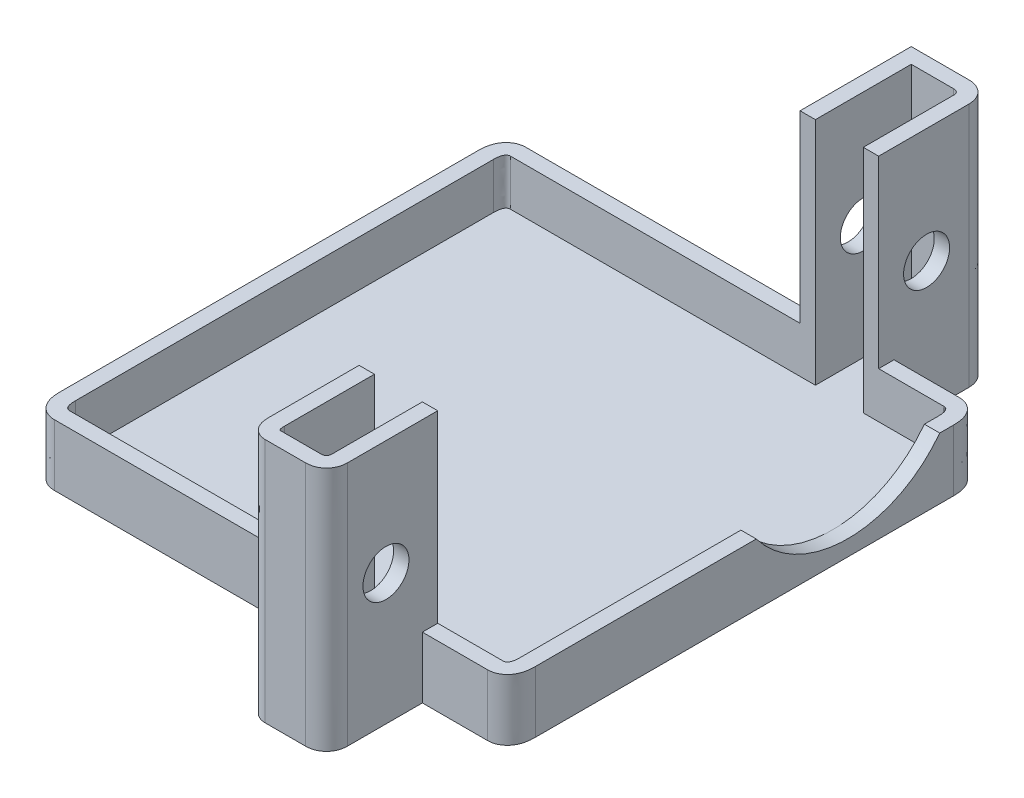
from build123d import *

# Parameters (mm, degrees)
EXTRUDE_THIN1_DEPTH     = 2.4
CUT_EXTRUDE1_DEPTH      = 10
BOSS_EXTRUDE1_DEPTH     = 0.8
BOSS_EXTRUDE2_DEPTH     = 9.6
CUT_EXTRUDE2_DEPTH      = 10
CUT_EXTRUDE2_DEPTH_BACK = 9.6
SKETCH5_R               = 1.2
BOSS_EXTRUDE3_DEPTH     = 9.6
CUT_EXTRUDE3_DEPTH      = 10
CUT_EXTRUDE3_DEPTH_BACK = 9.6
SKETCH8_R               = 1.2


# Read off the part's stored shape, not the designer's step: Extrude-Thin1
with BuildPart() as part:
    # Extrude-Thin1 outline → Extrude-Thin1 (new body)
    with BuildSketch(Plane(origin=(0, 27.577339236, 0), x_dir=(1, 0, 0), z_dir=(0, 1, 0))):
        with BuildLine():
            Line((-221.85268026, 260.465727588), (-224.85268026, 260.465727588))
            Line((-224.85268026, 260.465727588), (-224.85268026, 255.465727588))
            Line((-224.85268026, 255.465727588), (-239.95268026, 255.465727588))
            add(Edge.make_bspline(
                [(-239.95268026, 255.465727588), (-240.036953855, 255.465727588), (-240.119634905, 255.456128928), (-240.281715302, 255.417151974), (-240.361409143, 255.387305758), (-240.582321505, 255.271729013), (-240.710305754, 255.157186074), (-240.902423276, 254.88238325), (-240.965907148, 254.723899526), (-241.040211449, 254.398738857), (-241.05268026, 254.23302474), (-241.05268026, 254.065727588)],
                knots=[0, 0, 0, 0, 0.125, 0.125, 0.25, 0.25, 0.5, 0.5, 0.75, 0.75, 1, 1, 1, 1], degree=3))
            Line((-241.05268026, 254.065727588), (-241.05268026, 232.26572715))
            add(Edge.make_bspline(
                [(-241.05268026, 232.26572715), (-241.05268026, 232.098807375), (-241.040173408, 231.934007095), (-240.967365099, 231.612506131), (-240.904171119, 231.452780727), (-240.761375105, 231.246738134), (-240.705083291, 231.182493851), (-240.580845123, 231.071317608), (-240.512324697, 231.023373693), (-240.287950739, 230.905193813), (-240.121895067, 230.865727588), (-239.95268026, 230.865727588)],
                knots=[0, 0, 0, 0, 0.25, 0.25, 0.5, 0.5, 0.625, 0.625, 0.75, 0.75, 1, 1, 1, 1], degree=3))
            Line((-239.95268026, 230.865727588), (-224.85268026, 230.865727588))
            Line((-224.85268026, 230.865727588), (-224.85268026, 226.965727588))
            add(Edge.make_bspline(
                [(-224.85268026, 226.965727588), (-224.85268026, 226.832263963), (-224.842915454, 226.699977447), (-224.778312529, 226.440837832), (-224.722765281, 226.317121604), (-224.561642632, 226.104378576), (-224.457129257, 226.016716914), (-224.220278277, 225.897626505), (-224.087183417, 225.865727588), (-223.95268026, 225.865727588)],
                knots=[0, 0, 0, 0, 0.25, 0.25, 0.5, 0.5, 0.75, 0.75, 1, 1, 1, 1], degree=3))
            Line((-223.95268026, 225.865727588), (-221.85268026, 225.865727588))
            add(Edge.make_bspline(
                [(-221.85268026, 225.865727588), (-221.706401491, 225.865727588), (-221.561598635, 225.889080891), (-221.357734958, 225.966629211), (-221.293267189, 225.998955372), (-221.171531343, 226.076981138), (-221.11379386, 226.123323344), (-220.960069989, 226.2768079), (-220.879771324, 226.40237724), (-220.776526804, 226.672909538), (-220.75268026, 226.819308973), (-220.75268026, 226.965727588)],
                knots=[0, 0, 0, 0, 0.25, 0.25, 0.375, 0.375, 0.5, 0.5, 0.75, 0.75, 1, 1, 1, 1], degree=3))
            Line((-220.75268026, 226.965727588), (-220.75268026, 230.865727588))
            Line((-220.75268026, 230.865727588), (-217.35268026, 230.865727588))
            add(Edge.make_bspline(
                [(-217.35268026, 230.865727588), (-217.268406659, 230.865727588), (-217.185725604, 230.875326251), (-217.023645197, 230.914303211), (-216.943951352, 230.944149433), (-216.723038981, 231.059726197), (-216.595054733, 231.174269153), (-216.402937217, 231.449072013), (-216.339453355, 231.607555751), (-216.265149067, 231.932716443), (-216.25268026, 232.098430571), (-216.25268026, 232.265727733)],
                knots=[0, 0, 0, 0, 0.125, 0.125, 0.25, 0.25, 0.5, 0.5, 0.75, 0.75, 1, 1, 1, 1], degree=3))
            Line((-216.25268026, 232.265727733), (-216.25268026, 254.065727588))
            add(Edge.make_bspline(
                [(-216.25268026, 254.065727588), (-216.25268026, 254.232647394), (-216.265187101, 254.397447706), (-216.337995368, 254.718948734), (-216.401189322, 254.878674187), (-216.543985311, 255.084716854), (-216.600277123, 255.148961165), (-216.724515296, 255.260137461), (-216.793035717, 255.308081394), (-217.017409717, 255.426261342), (-217.183465417, 255.465727588), (-217.35268026, 255.465727588)],
                knots=[0, 0, 0, 0, 0.25, 0.25, 0.5, 0.5, 0.625, 0.625, 0.75, 0.75, 1, 1, 1, 1], degree=3))
            Line((-217.35268026, 255.465727588), (-220.75268026, 255.465727588))
            Line((-220.75268026, 255.465727588), (-220.75268026, 259.365727588))
            add(Edge.make_bspline(
                [(-220.75268026, 259.365727588), (-220.75268026, 259.512006357), (-220.776033562, 259.656809213), (-220.853581882, 259.86067289), (-220.885908043, 259.925140659), (-220.96393381, 260.046876505), (-221.010276016, 260.104613988), (-221.163760572, 260.258337859), (-221.289329911, 260.338636524), (-221.559862209, 260.441881044), (-221.706261645, 260.465727588), (-221.85268026, 260.465727588)],
                knots=[0, 0, 0, 0, 0.25, 0.25, 0.375, 0.375, 0.5, 0.5, 0.75, 0.75, 1, 1, 1, 1], degree=3))
        make_face()
        with BuildLine():
            Line((-224.05268026, 254.665727588), (-224.05268026, 259.665727588))
            Line((-224.05268026, 259.665727588), (-221.85268026, 259.665727588))
            add(Edge.make_bspline(
                [(-221.55268026, 259.365727588), (-221.55268026, 259.665727588), (-221.85268026, 259.665727588)],
                knots=[0, 0, 0, 1, 1, 1], degree=2))
            Line((-221.55268026, 259.365727588), (-221.55268026, 254.665727588))
            Line((-221.55268026, 254.665727588), (-217.35268026, 254.665727588))
            add(Edge.make_bspline(
                [(-217.05268026, 254.065727588), (-217.05268026, 254.665727588), (-217.35268026, 254.665727588)],
                knots=[0, 0, 0, 1, 1, 1], degree=2))
            Line((-217.05268026, 254.065727588), (-217.05268026, 232.265727733))
            add(Edge.make_bspline(
                [(-217.35268026, 231.665727588), (-217.05268026, 231.665727588), (-217.05268026, 232.265727733)],
                knots=[0, 0, 0, 1, 1, 1], degree=2))
            Line((-217.35268026, 231.665727588), (-221.55268026, 231.665727588))
            Line((-221.55268026, 231.665727588), (-221.55268026, 226.965727588))
            add(Edge.make_bspline(
                [(-221.85268026, 226.665727588), (-221.55268026, 226.665727588), (-221.55268026, 226.965727588)],
                knots=[0, 0, 0, 1, 1, 1], degree=2))
            Line((-221.85268026, 226.665727588), (-223.95268026, 226.665727588))
            add(Edge.make_bspline(
                [(-224.05268026, 226.965727588), (-224.05268026, 226.665727588), (-223.95268026, 226.665727588)],
                knots=[0, 0, 0, 1, 1, 1], degree=2))
            Line((-224.05268026, 226.965727588), (-224.05268026, 231.665727588))
            Line((-224.05268026, 231.665727588), (-239.95268026, 231.665727588))
            add(Edge.make_bspline(
                [(-240.25268026, 232.26572715), (-240.25268026, 231.665727588), (-239.95268026, 231.665727588)],
                knots=[0, 0, 0, 1, 1, 1], degree=2))
            Line((-240.25268026, 232.26572715), (-240.25268026, 254.065727588))
            add(Edge.make_bspline(
                [(-239.95268026, 254.665727588), (-240.25268026, 254.665727588), (-240.25268026, 254.065727588)],
                knots=[0, 0, 0, 1, 1, 1], degree=2))
            Line((-239.95268026, 254.665727588), (-224.05268026, 254.665727588))
        make_face(mode=Mode.SUBTRACT)
    extrude(amount=EXTRUDE_THIN1_DEPTH)

    # Sketch2 → Cut-Extrude1 (cut)
    with BuildSketch(Plane(origin=(-216.25268026, 0, 0), x_dir=(0, 0, -1), z_dir=(1, 0, 0))):
        with BuildLine():
            Line((243.543526876, 30.314428941), (253.35066228, 29.977339236))
            ThreePointArc((253.35066228, 29.977339236), (248.359618009, 27.600880377), (243.543526876, 30.314428941))
        make_face()
    extrude(amount=-CUT_EXTRUDE1_DEPTH, mode=Mode.SUBTRACT)

    # Sketch3 → Boss-Extrude1 (add)
    with BuildSketch(Plane.XZ.offset(-27.577339236)):
        with BuildLine():
            Line((-217.35268026, -255.465727588), (-220.75268026, -255.465727588))
            Line((-220.75268026, -255.465727588), (-220.75268026, -259.365727588))
            add(Edge.make_bspline(
                [(-220.75268026, -259.365727588), (-220.75268026, -259.512006357), (-220.776033562, -259.656809213), (-220.853581882, -259.86067289), (-220.885908043, -259.925140659), (-220.96393381, -260.046876505), (-221.010276016, -260.104613988), (-221.163760572, -260.258337859), (-221.289329911, -260.338636524), (-221.559862209, -260.441881044), (-221.706261645, -260.465727588), (-221.85268026, -260.465727588)],
                knots=[0, 0, 0, 0, 0.25, 0.25, 0.375, 0.375, 0.5, 0.5, 0.75, 0.75, 1, 1, 1, 1], degree=3))
            Line((-221.85268026, -260.465727588), (-224.85268026, -260.465727588))
            Line((-224.85268026, -260.465727588), (-224.85268026, -255.465727588))
            Line((-224.85268026, -255.465727588), (-239.95268026, -255.465727588))
            add(Edge.make_bspline(
                [(-239.95268026, -255.465727588), (-240.036953855, -255.465727588), (-240.119634905, -255.456128928), (-240.281715302, -255.417151974), (-240.361409143, -255.387305758), (-240.582321505, -255.271729013), (-240.710305754, -255.157186074), (-240.902423276, -254.88238325), (-240.965907148, -254.723899526), (-241.040211449, -254.398738857), (-241.05268026, -254.23302474), (-241.05268026, -254.065727588)],
                knots=[0, 0, 0, 0, 0.125, 0.125, 0.25, 0.25, 0.5, 0.5, 0.75, 0.75, 1, 1, 1, 1], degree=3))
            Line((-241.05268026, -254.065727588), (-241.05268026, -232.26572715))
            add(Edge.make_bspline(
                [(-241.05268026, -232.26572715), (-241.05268026, -232.098807375), (-241.040173408, -231.934007095), (-240.967365099, -231.612506131), (-240.904171119, -231.452780727), (-240.761375105, -231.246738134), (-240.705083291, -231.182493851), (-240.580845123, -231.071317608), (-240.512324697, -231.023373693), (-240.287950739, -230.905193813), (-240.121895067, -230.865727588), (-239.95268026, -230.865727588)],
                knots=[0, 0, 0, 0, 0.25, 0.25, 0.5, 0.5, 0.625, 0.625, 0.75, 0.75, 1, 1, 1, 1], degree=3))
            Line((-239.95268026, -230.865727588), (-224.85268026, -230.865727588))
            Line((-224.85268026, -230.865727588), (-224.85268026, -226.965727588))
            add(Edge.make_bspline(
                [(-224.85268026, -226.965727588), (-224.85268026, -226.832263963), (-224.842915454, -226.699977447), (-224.778312529, -226.440837832), (-224.722765281, -226.317121604), (-224.561642632, -226.104378576), (-224.457129257, -226.016716914), (-224.220278277, -225.897626505), (-224.087183417, -225.865727588), (-223.95268026, -225.865727588)],
                knots=[0, 0, 0, 0, 0.25, 0.25, 0.5, 0.5, 0.75, 0.75, 1, 1, 1, 1], degree=3))
            Line((-223.95268026, -225.865727588), (-221.85268026, -225.865727588))
            add(Edge.make_bspline(
                [(-221.85268026, -225.865727588), (-221.706401491, -225.865727588), (-221.561598635, -225.889080891), (-221.357734958, -225.966629211), (-221.293267189, -225.998955372), (-221.171531343, -226.076981138), (-221.11379386, -226.123323344), (-220.960069989, -226.2768079), (-220.879771324, -226.40237724), (-220.776526804, -226.672909538), (-220.75268026, -226.819308973), (-220.75268026, -226.965727588)],
                knots=[0, 0, 0, 0, 0.25, 0.25, 0.375, 0.375, 0.5, 0.5, 0.75, 0.75, 1, 1, 1, 1], degree=3))
            Line((-220.75268026, -226.965727588), (-220.75268026, -230.865727588))
            Line((-220.75268026, -230.865727588), (-217.35268026, -230.865727588))
            add(Edge.make_bspline(
                [(-217.35268026, -230.865727588), (-217.268406659, -230.865727588), (-217.185725604, -230.875326251), (-217.023645197, -230.914303211), (-216.943951352, -230.944149433), (-216.723038981, -231.059726197), (-216.595054733, -231.174269153), (-216.402937217, -231.449072013), (-216.339453355, -231.607555751), (-216.265149067, -231.932716443), (-216.25268026, -232.098430571), (-216.25268026, -232.265727733)],
                knots=[0, 0, 0, 0, 0.125, 0.125, 0.25, 0.25, 0.5, 0.5, 0.75, 0.75, 1, 1, 1, 1], degree=3))
            Line((-216.25268026, -232.265727733), (-216.25268026, -254.065727588))
            add(Edge.make_bspline(
                [(-216.25268026, -254.065727588), (-216.25268026, -254.232647394), (-216.265187101, -254.397447706), (-216.337995368, -254.718948734), (-216.401189322, -254.878674187), (-216.543985311, -255.084716854), (-216.600277123, -255.148961165), (-216.724515296, -255.260137461), (-216.793035717, -255.308081394), (-217.017409717, -255.426261342), (-217.183465417, -255.465727588), (-217.35268026, -255.465727588)],
                knots=[0, 0, 0, 0, 0.25, 0.25, 0.5, 0.5, 0.625, 0.625, 0.75, 0.75, 1, 1, 1, 1], degree=3))
        make_face()
    extrude(amount=BOSS_EXTRUDE1_DEPTH)

    # Sketch4 → Boss-Extrude2 (add)
    with BuildSketch(Plane(origin=(0, 29.977339236, 0), x_dir=(1, 0, 0), z_dir=(0, 1, 0))):
        with BuildLine():
            Line((-224.05268026, 231.665727588), (-224.85268026, 231.665727588))
            Line((-224.85268026, 231.665727588), (-224.85268026, 226.965727588))
            add(Edge.make_bspline(
                [(-224.85268026, 226.965727588), (-224.85268026, 226.832263963), (-224.842915454, 226.699977447), (-224.778312529, 226.440837832), (-224.722765281, 226.317121604), (-224.561642632, 226.104378576), (-224.457129257, 226.016716914), (-224.220278277, 225.897626505), (-224.087183417, 225.865727588), (-223.95268026, 225.865727588)],
                knots=[0, 0, 0, 0, 0.25, 0.25, 0.5, 0.5, 0.75, 0.75, 1, 1, 1, 1], degree=3))
            Line((-223.95268026, 225.865727588), (-221.85268026, 225.865727588))
            add(Edge.make_bspline(
                [(-221.85268026, 225.865727588), (-221.706401491, 225.865727588), (-221.561598635, 225.889080891), (-221.357734958, 225.966629211), (-221.293267189, 225.998955372), (-221.171531343, 226.076981138), (-221.11379386, 226.123323344), (-220.960069989, 226.2768079), (-220.879771324, 226.40237724), (-220.776526804, 226.672909538), (-220.75268026, 226.819308973), (-220.75268026, 226.965727588)],
                knots=[0, 0, 0, 0, 0.25, 0.25, 0.375, 0.375, 0.5, 0.5, 0.75, 0.75, 1, 1, 1, 1], degree=3))
            Line((-220.75268026, 226.965727588), (-220.75268026, 230.865727588))
            Line((-220.75268026, 230.865727588), (-220.75268026, 231.665727588))
            Line((-220.75268026, 231.665727588), (-221.55268026, 231.665727588))
            Line((-221.55268026, 231.665727588), (-221.55268026, 226.965727588))
            add(Edge.make_bspline(
                [(-221.85268026, 226.665727588), (-221.55268026, 226.665727588), (-221.55268026, 226.965727588)],
                knots=[0, 0, 0, 1, 1, 1], degree=2))
            Line((-221.85268026, 226.665727588), (-223.95268026, 226.665727588))
            add(Edge.make_bspline(
                [(-224.05268026, 226.965727588), (-224.05268026, 226.665727588), (-223.95268026, 226.665727588)],
                knots=[0, 0, 0, 1, 1, 1], degree=2))
            Line((-224.05268026, 226.965727588), (-224.05268026, 231.665727588))
        make_face()
    extrude(amount=BOSS_EXTRUDE2_DEPTH)

    # Sketch5 → Cut-Extrude2 (cut, two sides: drawn at the far end of the back side and taken through both)
    with BuildSketch(Plane(origin=(-224.05268026, 0, 0), x_dir=(0, 0, -1), z_dir=(1, 0, 0)).offset(-CUT_EXTRUDE2_DEPTH_BACK)):
        with Locations(Location((228.965727588, 33.597339236, 0), (0, 0, 180))):
            Circle(SKETCH5_R)
    extrude(amount=CUT_EXTRUDE2_DEPTH + CUT_EXTRUDE2_DEPTH_BACK, mode=Mode.SUBTRACT)

    # Sketch6 → Boss-Extrude3 (add)
    with BuildSketch(Plane(origin=(0, 29.977339236, 0), x_dir=(1, 0, 0), z_dir=(0, 1, 0))):
        with BuildLine():
            Line((-224.05268026, 254.665727588), (-224.85268026, 254.665727588))
            Line((-224.85268026, 254.665727588), (-224.85268026, 255.465727588))
            Line((-224.85268026, 255.465727588), (-224.85268026, 260.465727588))
            Line((-224.85268026, 260.465727588), (-221.85268026, 260.465727588))
            add(Edge.make_bspline(
                [(-220.75268026, 259.365727588), (-220.75268026, 259.512006357), (-220.776033562, 259.656809213), (-220.853581882, 259.86067289), (-220.885908043, 259.925140659), (-220.96393381, 260.046876505), (-221.010276016, 260.104613988), (-221.163760572, 260.258337859), (-221.289329911, 260.338636524), (-221.559862209, 260.441881044), (-221.706261645, 260.465727588), (-221.85268026, 260.465727588)],
                knots=[0, 0, 0, 0, 0.25, 0.25, 0.375, 0.375, 0.5, 0.5, 0.75, 0.75, 1, 1, 1, 1], degree=3))
            Line((-220.75268026, 259.365727588), (-220.75268026, 255.465727588))
            Line((-220.75268026, 255.465727588), (-220.75268026, 254.665727588))
            Line((-220.75268026, 254.665727588), (-221.55268026, 254.665727588))
            Line((-221.55268026, 254.665727588), (-221.55268026, 259.365727588))
            add(Edge.make_bspline(
                [(-221.55268026, 259.365727588), (-221.55268026, 259.665727588), (-221.85268026, 259.665727588)],
                knots=[0, 0, 0, 1, 1, 1], degree=2))
            Line((-221.85268026, 259.665727588), (-224.05268026, 259.665727588))
            Line((-224.05268026, 259.665727588), (-224.05268026, 254.665727588))
        make_face()
    extrude(amount=BOSS_EXTRUDE3_DEPTH)

    # Sketch8 → Cut-Extrude3 (cut, two sides: drawn at the far end of the back side and taken through both)
    with BuildSketch(Plane(origin=(-224.05268026, 0, 0), x_dir=(0, 0, -1), z_dir=(1, 0, 0)).offset(-CUT_EXTRUDE3_DEPTH_BACK)):
        with Locations(Location((257.165727588, 33.597339236, 0), (0, 0, 180))):
            Circle(SKETCH8_R)
    extrude(amount=CUT_EXTRUDE3_DEPTH + CUT_EXTRUDE3_DEPTH_BACK, mode=Mode.SUBTRACT)


solid = part.part
